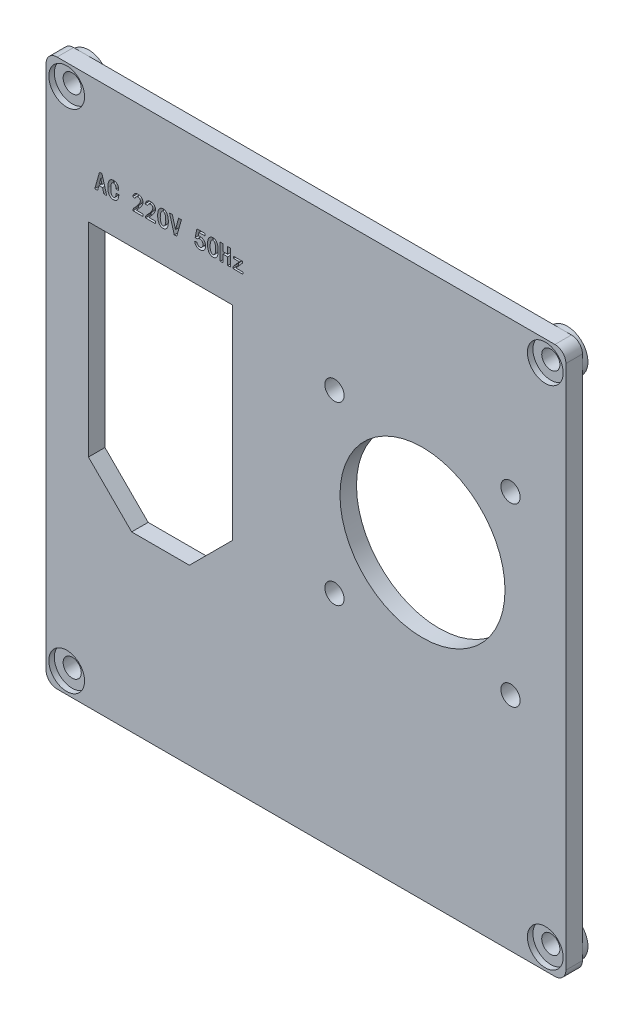
from build123d import *

# Parameters (mm, degrees)
SKETCH_1_R                  = 1.75
SKETCH_1_R_2                = 15
EXTRUDE_1_DEPTH             = 3
CUT_EXTRUDE_START           = 32.437993691
CUT_EXTRUDE_1_OUTLINE_W     = 0.515775918
CUT_EXTRUDE_1_OUTLINE_H     = 1
CUT_EXTRUDE_1_OUTLINE_W_2   = 0.515775917
CUT_EXTRUDE_1_DEPTH         = 3
CUT_EXTRUDE_START_2         = 32.454735481
CUT_EXTRUDE_1_2_OUTLINE_W   = 1.847392145
CUT_EXTRUDE_1_2_OUTLINE_H   = 1
CUT_EXTRUDE_1_2_OUTLINE_W_2 = 1.847392144
CUT_EXTRUDE_1_2_OUTLINE_W_3 = 1.779137154
CUT_EXTRUDE_1_2_DEPTH       = 0.112041111
CUT_EXTRUDE_START_3         = 34.11474836
CUT_EXTRUDE_1_3_OUTLINE_W   = 1.625241469
CUT_EXTRUDE_1_3_OUTLINE_H   = 1
CUT_EXTRUDE_1_3_DEPTH       = 0.316806181
CUT_EXTRUDE_1_4_OUTLINE_W   = 1.710882164
CUT_EXTRUDE_1_4_OUTLINE_H   = 1
CUT_EXTRUDE_1_4_DEPTH       = 0.355441082
CUT_EXTRUDE_START_4         = 33.803093498
CUT_EXTRUDE_1_5_OUTLINE_W   = 0.849323889
CUT_EXTRUDE_1_5_OUTLINE_H   = 1
CUT_EXTRUDE_1_5_DEPTH       = 0.406310367
CUT_EXTRUDE_1_6_OUTLINE_W   = 0.06825499
CUT_EXTRUDE_1_6_OUTLINE_H   = 1
CUT_EXTRUDE_1_6_DEPTH       = 0.329040567
CUT_EXTRUDE_START_5         = 2
CUT_EXTRUDE_1_7_DEPTH       = 2
SKETCH_3_R                  = 3.75
EXTRUDE_2_DEPTH             = 1
SKETCH_4_R                  = 1.65
CUT_EXTRUDE_2_DEPTH         = 69.72863319
SKETCH_5_R                  = 3.25
CUT_EXTRUDE_3_DEPTH         = 1


with BuildPart() as part:
    # 草图1 → 凸台-拉伸1 (new body)
    with BuildSketch(Plane.XY):
        with BuildLine():
            Line((-45.25, -49.75), (45.25, -49.75))
            ThreePointArc((45.25, -49.75), (46.664213562, -49.164213562), (47.25, -47.75))
            Line((47.25, -47.75), (47.25, 47.75))
            ThreePointArc((47.25, 47.75), (46.664213562, 49.164213562), (45.25, 49.75))
            Line((45.25, 49.75), (-45.25, 49.75))
            ThreePointArc((-45.25, 49.75), (-46.664213562, 49.164213562), (-47.25, 47.75))
            Line((-47.25, 47.75), (-47.25, -47.75))
            ThreePointArc((-47.25, -47.75), (-46.664213562, -49.164213562), (-45.25, -49.75))
        make_face()
        with Locations((5.176207271, 22.529672013)):
            Circle(SKETCH_1_R, mode=Mode.SUBTRACT)
        with Locations((37.176207271, 22.529672013)):
            Circle(SKETCH_1_R, mode=Mode.SUBTRACT)
        with Locations((37.176207271, -9.470327987)):
            Circle(SKETCH_1_R, mode=Mode.SUBTRACT)
        with Locations((5.176207271, -9.470327987)):
            Circle(SKETCH_1_R, mode=Mode.SUBTRACT)
        with Locations((21.176207271, 6.529672013)):
            Circle(SKETCH_1_R_2, mode=Mode.SUBTRACT)
        Polygon((-39.546370112, 26.657371429), (-13.337865468, 26.657371429), (-13.337865468, -10.372264242), (-21.192935607, -18.227334381), (-31.691299973, -18.227334381), (-39.546370112, -10.372264242), align=None, mode=Mode.SUBTRACT)
    extrude(amount=EXTRUDE_1_DEPTH)

    # 切除-拉伸1: read off the stored shape, not the designer's step
    # 切除-拉伸1 outline → 切除-拉伸1 (cut)
    with BuildSketch(Plane(origin=(0, 0, 0), x_dir=(1, 0, 0), z_dir=(0, 1, 0)).offset(CUT_EXTRUDE_START)):
        with Locations((-13.968422965, -2.5)):
            Rectangle(CUT_EXTRUDE_1_OUTLINE_W, CUT_EXTRUDE_1_OUTLINE_H)
        with Locations((-15.333522772, -2.5)):
            Rectangle(CUT_EXTRUDE_1_OUTLINE_W_2, CUT_EXTRUDE_1_OUTLINE_H)
    extrude(amount=CUT_EXTRUDE_1_DEPTH, mode=Mode.SUBTRACT)

    # Cut-Extrude 1 2 outline → Cut-Extrude 1 2 (cut)
    with BuildSketch(Plane(origin=(0, 0, 0), x_dir=(1, 0, 0), z_dir=(0, 1, 0)).offset(CUT_EXTRUDE_START_2)):
        with Locations((-30.517038548, -2.5)):
            Rectangle(CUT_EXTRUDE_1_2_OUTLINE_W, CUT_EXTRUDE_1_2_OUTLINE_H)
        with Locations((-28.250457736, -2.5)):
            Rectangle(CUT_EXTRUDE_1_2_OUTLINE_W_2, CUT_EXTRUDE_1_2_OUTLINE_H)
        with Locations((-12.384392057, -2.5)):
            Rectangle(CUT_EXTRUDE_1_2_OUTLINE_W_3, CUT_EXTRUDE_1_2_OUTLINE_H)
    extrude(amount=CUT_EXTRUDE_1_2_DEPTH, mode=Mode.SUBTRACT)

    # Cut-Extrude 1 3 outline → Cut-Extrude 1 3 (cut)
    with BuildSketch(Plane(origin=(0, 0, 0), x_dir=(1, 0, 0), z_dir=(0, 1, 0)).offset(CUT_EXTRUDE_START_3)):
        with Locations((-12.39308491, -2.5)):
            Rectangle(CUT_EXTRUDE_1_3_OUTLINE_W, CUT_EXTRUDE_1_3_OUTLINE_H)
    extrude(amount=CUT_EXTRUDE_1_3_DEPTH, mode=Mode.SUBTRACT)

    # Cut-Extrude 1 4 outline → Cut-Extrude 1 4 (cut)
    with BuildSketch(Plane(origin=(0, 0, 0), x_dir=(1, 0, 0), z_dir=(0, 1, 0)).offset(CUT_EXTRUDE_START)):
        with Locations((-12.350264562, -2.5)):
            Rectangle(CUT_EXTRUDE_1_4_OUTLINE_W, CUT_EXTRUDE_1_4_OUTLINE_H)
    extrude(amount=CUT_EXTRUDE_1_4_DEPTH, mode=Mode.SUBTRACT)

    # Cut-Extrude 1 5 outline → Cut-Extrude 1 5 (cut)
    with BuildSketch(Plane(origin=(0, 0, 0), x_dir=(1, 0, 0), z_dir=(0, 1, 0)).offset(CUT_EXTRUDE_START_4)):
        with Locations((-14.650972869, -2.5)):
            Rectangle(CUT_EXTRUDE_1_5_OUTLINE_W, CUT_EXTRUDE_1_5_OUTLINE_H)
    extrude(amount=CUT_EXTRUDE_1_5_DEPTH, mode=Mode.SUBTRACT)

    # Cut-Extrude 1 6 outline → Cut-Extrude 1 6 (cut)
    with BuildSketch(Plane(origin=(0, 0, 0), x_dir=(1, 0, 0), z_dir=(0, 1, 0)).offset(CUT_EXTRUDE_START)):
        with Locations((-13.239833139, -2.5)):
            Rectangle(CUT_EXTRUDE_1_6_OUTLINE_W, CUT_EXTRUDE_1_6_OUTLINE_H)
    extrude(amount=CUT_EXTRUDE_1_6_DEPTH, mode=Mode.SUBTRACT)

    # Cut-Extrude 1 7 outline → Cut-Extrude 1 7 (cut)
    with BuildSketch(Plane.XY.offset(CUT_EXTRUDE_START_5)):
        with BuildLine():
            add(Edge.make_bspline(
                [(-17.892119037, 34.128270575), (-17.890696642, 34.165641823), (-17.887121571, 34.238507118), (-17.877981101, 34.344565154), (-17.86657254, 34.444903851), (-17.852013781, 34.539267275), (-17.833791644, 34.627705183), (-17.813471807, 34.710352965), (-17.789744137, 34.787173153), (-17.753884053, 34.880804228), (-17.701382584, 34.989437243), (-17.625059007, 35.108960492), (-17.535407508, 35.216325394), (-17.451367259, 35.296462565), (-17.377543042, 35.352666192), (-17.318150166, 35.389539302), (-17.254883884, 35.42044642), (-17.188154791, 35.44545014), (-17.118266573, 35.465703637), (-17.044542741, 35.479729806), (-16.967228258, 35.488006258), (-16.887397568, 35.490393737), (-16.807045456, 35.487510364), (-16.728575542, 35.4740096), (-16.652687981, 35.453585757), (-16.579644128, 35.424446821), (-16.509672561, 35.386837809), (-16.442956588, 35.340572233), (-16.379033245, 35.286111164), (-16.318413435, 35.224106733), (-16.262540703, 35.15579349), (-16.209637499, 35.084795009), (-16.164458691, 35.008654946), (-16.122687144, 34.930390032), (-16.087611101, 34.847834255), (-16.056028715, 34.762419204), (-16.032281099, 34.672508459), (-16.005148036, 34.546897887), (-15.9825224, 34.380691879), (-15.97009504, 34.225029144), (-15.966186349, 34.134931511), (-15.965468152, 34.11474836)],
                knots=[0, 0, 0, 0, 0.01375814, 0.02683405, 0.039155756, 0.050904718, 0.061946445, 0.072364933, 0.082205407, 0.091503087, 0.109231915, 0.126492414, 0.143538444, 0.160575876, 0.169088276, 0.177634305, 0.186251179, 0.194948003, 0.203820502, 0.212988516, 0.222519663, 0.232395241, 0.242356006, 0.252040315, 0.261618449, 0.271222912, 0.280903035, 0.290781455, 0.301033734, 0.311754852, 0.322633587, 0.3334842, 0.344291052, 0.355169787, 0.366098274, 0.377263545, 0.388642339, 0.40027369, 0.424528945, 0.450274304, 0.457703597, 0.457703597, 0.457703597, 0.457703597], degree=3))
            add(Edge.make_bspline(
                [(-17.892616098, 34.11474836), (-17.892456166, 34.119255937), (-17.892290588, 34.123763346), (-17.892119037, 34.128270575)],
                knots=[0.998340674, 0.998340674, 0.998340674, 0.998340674, 1, 1, 1, 1], degree=3))
            Line((-17.892616098, 34.11474836), (-17.421181141, 34.11474836))
            add(Edge.make_bspline(
                [(-17.41111453, 34.22678957), (-17.415082506, 34.189498468), (-17.418422869, 34.15214396), (-17.421181141, 34.11474836)],
                knots=[0, 0, 0, 0, 0.02075965, 0.02075965, 0.02075965, 0.02075965], degree=3))
            add(Edge.make_bspline(
                [(-16.431048092, 34.11474836), (-16.431057352, 34.114962999), (-16.433152925, 34.163496819), (-16.437979413, 34.258054022), (-16.448997325, 34.396102362), (-16.466431633, 34.527431733), (-16.496815993, 34.651429407), (-16.539326146, 34.767618481), (-16.584321231, 34.857864237), (-16.625344447, 34.923301433), (-16.657613901, 34.96663992), (-16.692345355, 35.002932941), (-16.727983989, 35.034266193), (-16.766172194, 35.058059334), (-16.806084652, 35.075744732), (-16.847669231, 35.087603092), (-16.890693569, 35.092607326), (-16.934097136, 35.091367318), (-16.976866799, 35.083572571), (-17.018844433, 35.069190157), (-17.059543535, 35.047442928), (-17.099631029, 35.019451173), (-17.138969343, 34.985183687), (-17.177135592, 34.944016209), (-17.214420683, 34.896379659), (-17.250287542, 34.841386752), (-17.282035714, 34.777619918), (-17.312008697, 34.706196995), (-17.336773269, 34.625851523), (-17.36143762, 34.538122072), (-17.380435147, 34.441521827), (-17.398136716, 34.337020134), (-17.407108458, 34.264438689), (-17.41111453, 34.22678957)],
                knots=[0.581565079, 0.581565079, 0.581565079, 0.581565079, 0.581684015, 0.608458794, 0.63397824, 0.658345663, 0.681719281, 0.704501222, 0.726714831, 0.737396332, 0.747235582, 0.756565828, 0.76516276, 0.773438321, 0.78136528, 0.789265473, 0.797283646, 0.805248812, 0.81322018, 0.821262092, 0.829713246, 0.838679214, 0.848281689, 0.85853832, 0.869710881, 0.881741515, 0.89481499, 0.909092914, 0.924575528, 0.941323834, 0.959525027, 0.979041045, 1, 1, 1, 1], degree=3))
            Line((-16.431048092, 34.11474836), (-15.965468152, 34.11474836))
        make_face()
        with BuildLine():
            add(Edge.make_bspline(
                [(-15.965468152, 34.11474836), (-15.963536806, 34.060472603), (-15.961588077, 33.927321129), (-15.966884374, 33.754408086), (-15.977539461, 33.597929793), (-15.989576246, 33.484049342), (-16.006020098, 33.375672697), (-16.024532412, 33.272231729), (-16.049608446, 33.174510916), (-16.076942589, 33.081508644), (-16.108380771, 32.993920075), (-16.143929135, 32.911697408), (-16.18333993, 32.834646591), (-16.229658891, 32.763941173), (-16.280968617, 32.69908582), (-16.33743758, 32.639753169), (-16.387793088, 32.596806704), (-16.419256339, 32.57365332), (-16.42902494, 32.566776592)],
                knots=[0.457703597, 0.457703597, 0.457703597, 0.457703597, 0.477682166, 0.506675045, 0.521319447, 0.535376407, 0.548788473, 0.561642915, 0.57401487, 0.585881854, 0.597296758, 0.608225244, 0.618820876, 0.629092903, 0.639267036, 0.649208376, 0.6591779, 0.663571181, 0.663571181, 0.663571181, 0.663571181], degree=3))
            Line((-15.965468152, 34.11474836), (-16.431048092, 34.11474836))
            add(Edge.make_bspline(
                [(-17.421181141, 34.11474836), (-17.421260296, 34.113675202), (-17.424058389, 34.075507366), (-17.428330778, 34.001070736), (-17.431519135, 33.892378036), (-17.428206185, 33.786939101), (-17.423211944, 33.684595482), (-17.411905359, 33.585809565), (-17.397065145, 33.490007828), (-17.37889301, 33.398129456), (-17.356230241, 33.311428693), (-17.331336714, 33.231266573), (-17.304402213, 33.157711048), (-17.274411243, 33.091545107), (-17.241348959, 33.032360354), (-17.206026875, 32.980223611), (-17.168726472, 32.934258189), (-17.128029296, 32.896469988), (-17.086164139, 32.865261705), (-17.043525865, 32.841218555), (-17.000668132, 32.824102554), (-16.957453071, 32.814152406), (-16.913702086, 32.81151729), (-16.869698101, 32.816386016), (-16.825223615, 32.827171349), (-16.781514932, 32.84640665), (-16.738860169, 32.871388472), (-16.697619222, 32.901619257), (-16.660562062, 32.938961204), (-16.625417185, 32.981040699), (-16.593288827, 33.029058745), (-16.563748432, 33.082456936), (-16.537214599, 33.141743933), (-16.505730246, 33.228975779), (-16.473271091, 33.345603331), (-16.444850254, 33.492001293), (-16.4282509, 33.645364659), (-16.423561602, 33.803063354), (-16.425236051, 33.960252205), (-16.428863414, 34.064110006), (-16.431048092, 34.11474836)],
                knots=[0.02075965, 0.02075965, 0.02075965, 0.02075965, 0.021355399, 0.041947328, 0.062035245, 0.081529183, 0.100334779, 0.118745782, 0.136543744, 0.153998836, 0.170571273, 0.186131217, 0.200456533, 0.213910078, 0.22630606, 0.237940496, 0.248742933, 0.258999564, 0.268601304, 0.277592435, 0.28602184, 0.29406463, 0.302040425, 0.310163575, 0.318492712, 0.327277305, 0.336489515, 0.345829594, 0.355492903, 0.365534577, 0.376147113, 0.38742346, 0.399283875, 0.412065712, 0.438736923, 0.466213421, 0.494545127, 0.5240344, 0.553505232, 0.581565079, 0.581565079, 0.581565079, 0.581565079], degree=3))
            Line((-17.421181141, 34.11474836), (-17.892616098, 34.11474836))
            add(Edge.make_bspline(
                [(-17.393412018, 32.566776592), (-17.414483751, 32.580765343), (-17.455206019, 32.610075048), (-17.511546857, 32.658487896), (-17.563621409, 32.708971567), (-17.608683541, 32.763807388), (-17.649207088, 32.820807364), (-17.692760889, 32.902172857), (-17.740251627, 33.006461019), (-17.788395252, 33.134833197), (-17.828876886, 33.265595251), (-17.853837712, 33.377819093), (-17.870589201, 33.471411806), (-17.879740221, 33.547981991), (-17.887704006, 33.630401887), (-17.892516541, 33.718696765), (-17.89569899, 33.812726537), (-17.897136322, 33.912559915), (-17.895573739, 34.013883876), (-17.893781008, 34.081916289), (-17.892616098, 34.11474836)],
                knots=[0.790168782, 0.790168782, 0.790168782, 0.790168782, 0.799471656, 0.808601844, 0.817479964, 0.826114187, 0.834679165, 0.843161847, 0.860016036, 0.876808885, 0.893569584, 0.910331214, 0.919068096, 0.928539194, 0.938690933, 0.949527458, 0.961062992, 0.973303463, 0.986254556, 0.998340674, 0.998340674, 0.998340674, 0.998340674], degree=3))
            Line((-17.393412018, 32.566776592), (-16.42902494, 32.566776592))
        make_face()
        with BuildLine():
            add(Edge.make_bspline(
                [(-16.42902494, 32.566776592), (-16.441709922, 32.557846841), (-16.477878945, 32.533834521), (-16.54057517, 32.498442307), (-16.617792008, 32.463150067), (-16.69783264, 32.435707183), (-16.778203242, 32.416073798), (-16.85831526, 32.405777396), (-16.937985016, 32.403568891), (-17.017205545, 32.410896499), (-17.096054534, 32.426391856), (-17.174042611, 32.451202484), (-17.250660036, 32.483826398), (-17.323447106, 32.52305657), (-17.370516497, 32.551595979), (-17.393088466, 32.566561798), (-17.393412018, 32.566776592)],
                knots=[0.663571181, 0.663571181, 0.663571181, 0.663571181, 0.669276061, 0.679530773, 0.690026183, 0.700464403, 0.710615221, 0.720409648, 0.730125134, 0.739876495, 0.749617299, 0.759632065, 0.769928041, 0.78020735, 0.790025939, 0.790168782, 0.790168782, 0.790168782, 0.790168782], degree=3))
            Line((-16.42902494, 32.566776592), (-17.393412018, 32.566776592))
        make_face()
        Polygon((-11.580464175, 34.11474836), (-13.205705644, 34.11474836), (-13.205705644, 34.076113459), (-12.113625798, 34.076113459), (-13.273960634, 32.767034258), (-13.205705644, 32.767034258), (-13.205705644, 32.793434773), (-12.740799011, 32.793434773), align=None)
        with BuildLine():
            Line((-20.106349172, 34.11474836), (-18.436437247, 34.11474836))
            add(Edge.make_bspline(
                [(-19.625538226, 34.380041341), (-19.611530001, 34.389525035), (-19.583598469, 34.408434934), (-19.538728681, 34.432329551), (-19.491532395, 34.452320997), (-19.442032741, 34.468505392), (-19.390023759, 34.479995874), (-19.335776973, 34.487649351), (-19.278960065, 34.49166866), (-19.200134469, 34.490294487), (-19.100873737, 34.480940163), (-18.982414145, 34.459486253), (-18.866516738, 34.423882755), (-18.754182165, 34.379166482), (-18.649698338, 34.325519223), (-18.560152081, 34.260350468), (-18.487585374, 34.191268651), (-18.451560614, 34.139231936), (-18.436437247, 34.11474836)],
                knots=[0, 0, 0, 0, 0.009976857, 0.019893235, 0.029938193, 0.040191786, 0.050577508, 0.061324553, 0.072496083, 0.084149044, 0.107805093, 0.131255114, 0.155056848, 0.179211149, 0.202553181, 0.224138131, 0.244379192, 0.261329406, 0.261329406, 0.261329406, 0.261329406], degree=3))
            add(Edge.make_bspline(
                [(-19.46391556, 35.031683324), (-19.470476747, 34.997108404), (-19.483206627, 34.930026858), (-19.503276387, 34.832594022), (-19.523063805, 34.741542109), (-19.542902812, 34.656656155), (-19.563670156, 34.578666264), (-19.583409934, 34.506561682), (-19.603898729, 34.441082032), (-19.61855207, 34.399747887), (-19.625538226, 34.380041341)],
                knots=[0, 0, 0, 0, 0.1570846, 0.304772297, 0.444024214, 0.572999318, 0.693839289, 0.804255937, 0.906676684, 1, 1, 1, 1], degree=3))
            Line((-19.46391556, 35.031683324), (-18.362820904, 35.031683324))
            Line((-18.362820904, 35.031683324), (-18.362820904, 35.421251901))
            Line((-18.362820904, 35.421251901), (-19.827083622, 35.421251901))
            add(Edge.make_bspline(
                [(-20.106349172, 34.11474836), (-20.102729834, 34.130838717), (-20.09299233, 34.17411731), (-20.077721803, 34.248118797), (-20.057507108, 34.33945307), (-20.035346319, 34.440660845), (-20.012908343, 34.552138485), (-19.985766981, 34.672898584), (-19.958457118, 34.803740819), (-19.928812718, 34.944369018), (-19.896619159, 35.094570843), (-19.862354963, 35.254661888), (-19.839081909, 35.364582809), (-19.827083622, 35.421251901)],
                knots=[0.154059826, 0.154059826, 0.154059826, 0.154059826, 0.185387301, 0.238324019, 0.297582749, 0.363077412, 0.435122637, 0.513574185, 0.598176239, 0.689014721, 0.786573079, 0.88996899, 1, 1, 1, 1], degree=3))
        make_face()
        with BuildLine():
            add(Edge.make_bspline(
                [(-18.436437247, 34.11474836), (-18.434193162, 34.111115358), (-18.415353508, 34.08007913), (-18.383885133, 34.020637387), (-18.344185068, 33.93687401), (-18.312672048, 33.853167642), (-18.287125804, 33.770027263), (-18.267944338, 33.685504792), (-18.256953512, 33.598177205), (-18.250668023, 33.507843463), (-18.25255674, 33.414676075), (-18.259541641, 33.319407062), (-18.276496005, 33.222939172), (-18.299398746, 33.125159313), (-18.329949401, 33.027429512), (-18.368201048, 32.932434433), (-18.417669241, 32.84392675), (-18.477158781, 32.763023211), (-18.54676594, 32.689945386), (-18.625084364, 32.624078913), (-18.682498418, 32.585348208), (-18.712524997, 32.566991079), (-18.712876245, 32.566776592)],
                knots=[0.261329406, 0.261329406, 0.261329406, 0.261329406, 0.263844567, 0.282716609, 0.301019044, 0.318496537, 0.335444207, 0.352314082, 0.369563844, 0.387332166, 0.405698908, 0.424505385, 0.443640794, 0.46342496, 0.483734459, 0.504009175, 0.523741379, 0.543399058, 0.5631093, 0.583153252, 0.603668649, 0.603911399, 0.603911399, 0.603911399, 0.603911399], degree=3))
            Line((-18.436437247, 34.11474836), (-20.106349172, 34.11474836))
            add(Edge.make_bspline(
                [(-20.158699848, 33.877143723), (-20.157005059, 33.88487584), (-20.152902485, 33.903592959), (-20.14499967, 33.936342185), (-20.135200673, 33.978981998), (-20.124723497, 34.031760796), (-20.114595649, 34.078083675), (-20.108135312, 34.106807782), (-20.106349172, 34.11474836)],
                knots=[0, 0, 0, 0, 0.015035692, 0.036396868, 0.063992105, 0.098135437, 0.138599743, 0.154059826, 0.154059826, 0.154059826, 0.154059826], degree=3))
            Line((-20.158699848, 33.877143723), (-19.778789996, 33.837220993))
            add(Edge.make_bspline(
                [(-19.830303197, 33.339474696), (-19.819795954, 33.302123773), (-19.799804995, 33.231060334), (-19.76114871, 33.133050824), (-19.721117991, 33.047133267), (-19.674563757, 32.975754726), (-19.626367547, 32.915896153), (-19.5724745, 32.870515104), (-19.51504581, 32.837559355), (-19.453623832, 32.820373175), (-19.392866558, 32.812454115), (-19.33415168, 32.807238822), (-19.277947371, 32.808350873), (-19.224246659, 32.812361414), (-19.17318797, 32.821846107), (-19.125222488, 32.837338505), (-19.079153597, 32.855313135), (-19.023200565, 32.887731221), (-18.959135439, 32.933843386), (-18.892683999, 32.998603117), (-18.838413024, 33.072026012), (-18.795859823, 33.153157914), (-18.764517591, 33.240826957), (-18.744054202, 33.334123937), (-18.733160732, 33.432109707), (-18.732643629, 33.533100924), (-18.742135402, 33.632649131), (-18.764014741, 33.726289519), (-18.797213158, 33.811892256), (-18.843624482, 33.887268708), (-18.897884843, 33.953001692), (-18.959982319, 34.007536902), (-19.029215079, 34.050050957), (-19.104924775, 34.080016722), (-19.185408635, 34.099009873), (-19.269864471, 34.105085968), (-19.357476558, 34.099581337), (-19.431709369, 34.085951836), (-19.491635283, 34.068518864), (-19.535938929, 34.049595864), (-19.579560804, 34.026242979), (-19.621893676, 33.997811247), (-19.663192697, 33.964811905), (-19.703365025, 33.927259258), (-19.742129919, 33.884448526), (-19.766331036, 33.853271313), (-19.778789996, 33.837220993)],
                knots=[0, 0, 0, 0, 0.034936196, 0.066469208, 0.09483979, 0.120159877, 0.143089317, 0.163815179, 0.18329447, 0.202263043, 0.220834079, 0.238485091, 0.25531164, 0.27142048, 0.286971718, 0.301958335, 0.316790674, 0.331423724, 0.360088745, 0.387713903, 0.414673727, 0.442011033, 0.469967938, 0.498307523, 0.527886972, 0.558637517, 0.589157929, 0.617772671, 0.645030509, 0.671498197, 0.697176183, 0.721573204, 0.745620481, 0.770005234, 0.794633417, 0.819849149, 0.846003388, 0.87354176, 0.887675543, 0.902150546, 0.916860076, 0.932200645, 0.948027232, 0.964446527, 0.981696742, 1, 1, 1, 1], degree=3))
            Line((-19.830303197, 33.339474696), (-20.244340544, 33.241599615))
            add(Edge.make_bspline(
                [(-19.866783073, 32.566776592), (-19.88282671, 32.577282387), (-19.919491495, 32.602453902), (-19.974074402, 32.647834049), (-20.026598375, 32.707290537), (-20.07506395, 32.77463046), (-20.119110094, 32.850726871), (-20.158114306, 32.935730209), (-20.192000133, 33.029760571), (-20.221941959, 33.132266856), (-20.236707666, 33.204341743), (-20.244340544, 33.241599615)],
                knots=[0.843503786, 0.843503786, 0.843503786, 0.843503786, 0.854817764, 0.869737288, 0.885251897, 0.901491932, 0.918631607, 0.937048937, 0.956602293, 0.977566302, 1, 1, 1, 1], degree=3))
            Line((-19.866783073, 32.566776592), (-18.712876245, 32.566776592))
        make_face()
        with BuildLine():
            add(Edge.make_bspline(
                [(-18.712876245, 32.566776592), (-18.743283945, 32.54820832), (-18.807585766, 32.512836153), (-18.910658153, 32.467931495), (-19.022193356, 32.432185914), (-19.141675073, 32.408974103), (-19.268396558, 32.399206772), (-19.377897123, 32.400958096), (-19.467230422, 32.410200633), (-19.534213212, 32.42167616), (-19.600445905, 32.438329215), (-19.66503118, 32.461411567), (-19.729422522, 32.48735185), (-19.791989578, 32.520060636), (-19.837275831, 32.547677892), (-19.862153006, 32.563744703), (-19.866783073, 32.566776592)],
                knots=[0.603911399, 0.603911399, 0.603911399, 0.603911399, 0.624926349, 0.647161813, 0.670153821, 0.693900225, 0.71880721, 0.745029719, 0.758401288, 0.771769257, 0.785101177, 0.798639659, 0.812211276, 0.826032945, 0.840238662, 0.843503786, 0.843503786, 0.843503786, 0.843503786], degree=3))
            Line((-18.712876245, 32.566776592), (-19.866783073, 32.566776592))
        make_face()
        Polygon((-23.51725031, 34.11474836), (-23.017776481, 34.11474836), (-22.640348271, 35.437993691), (-23.163851168, 35.437993691), align=None)
        Polygon((-23.459303233, 32.566776592), (-23.017776481, 34.11474836), (-23.51725031, 34.11474836), (-23.726973063, 33.329475789), (-23.936922053, 34.11474836), (-24.43532475, 34.11474836), (-23.995112065, 32.566776592), align=None)
        Polygon((-23.505770035, 32.403866196), (-23.459303233, 32.566776592), (-23.995112065, 32.566776592), (-23.948783557, 32.403866196), align=None)
        Polygon((-24.43532475, 34.11474836), (-23.936922053, 34.11474836), (-24.290702424, 35.437993691), (-24.811629662, 35.437993691), align=None)
        with BuildLine():
            Line((-29.174153808, 32.566776692), (-27.326761664, 32.566776592))
            Line((-27.326761664, 32.566776592), (-27.326761664, 32.844304058))
            Line((-27.326761664, 32.844304058), (-28.55535149, 32.844304058))
            add(Edge.make_bspline(
                [(-27.537596449, 34.11474836), (-27.551695594, 34.089186755), (-27.583959063, 34.032569389), (-27.639960199, 33.943873007), (-27.707833884, 33.843544242), (-27.789700348, 33.73463258), (-27.883616405, 33.6131271), (-27.992001285, 33.481164019), (-28.11297615, 33.337105275), (-28.24870963, 33.183144304), (-28.396457309, 33.016511896), (-28.501059081, 32.903145599), (-28.55535149, 32.844304058)],
                knots=[0.557585185, 0.557585185, 0.557585185, 0.557585185, 0.58133334, 0.610601225, 0.642910399, 0.679865703, 0.721436889, 0.767860717, 0.818799669, 0.874494463, 0.934857719, 1, 1, 1, 1], degree=3))
            Line((-27.537596449, 34.11474836), (-28.056386169, 34.11474836))
            add(Edge.make_bspline(
                [(-29.174153808, 32.566776692), (-29.17210011, 32.58917879), (-29.167995245, 32.633955376), (-29.152530128, 32.699366109), (-29.132045347, 32.763393041), (-29.104237148, 32.825058448), (-29.069776222, 32.884690873), (-29.028929677, 32.942143285), (-28.981818289, 32.997806631), (-28.927017357, 33.05116015), (-28.867569072, 33.106913076), (-28.805560768, 33.169893305), (-28.740298884, 33.239871246), (-28.671434174, 33.316551106), (-28.598967045, 33.399952809), (-28.523404955, 33.490507731), (-28.444066181, 33.588026485), (-28.362875879, 33.689776836), (-28.283808068, 33.792121645), (-28.210607845, 33.890595252), (-28.14401816, 33.982212082), (-28.093822926, 34.056532328), (-28.065702266, 34.100085682), (-28.056386169, 34.11474836)],
                knots=[0, 0, 0, 0, 0.016926228, 0.033831593, 0.050499485, 0.067506599, 0.084672818, 0.102302554, 0.120540831, 0.139518724, 0.15987365, 0.181938605, 0.206074378, 0.231948146, 0.259568851, 0.289295459, 0.32078355, 0.354265258, 0.387347976, 0.418196573, 0.446689801, 0.472653833, 0.485739218, 0.485739218, 0.485739218, 0.485739218], degree=3))
        make_face()
        Polygon((-37.436884977, 34.11474836), (-37.916536971, 34.11474836), (-38.393728824, 32.437993691), (-37.872157672, 32.437993691), (-37.633265206, 33.342050356), (-36.985486712, 33.342050356), (-36.746594246, 32.437993691), (-36.222447434, 32.437993691), (-36.701062678, 34.11474836), (-37.180918378, 34.11474836), (-37.080142218, 33.749004638), (-37.536677955, 33.749004638), align=None)
        Polygon((-37.530238805, 35.472121186), (-37.916536971, 34.11474836), (-37.436884977, 34.11474836), (-37.309529047, 34.581510982), (-37.180918378, 34.11474836), (-36.701062678, 34.11474836), (-37.088513113, 35.472121186), align=None)
        with BuildLine():
            Line((-26.459735263, 32.566776592), (-25.495348185, 32.566776592))
            add(Edge.make_bspline(
                [(-25.031791398, 34.11474836), (-25.029860051, 34.060472603), (-25.027911322, 33.927321129), (-25.033207619, 33.754408086), (-25.043862706, 33.597929793), (-25.055899491, 33.484049342), (-25.072343343, 33.375672697), (-25.090855657, 33.272231729), (-25.115931691, 33.174510916), (-25.143265834, 33.081508644), (-25.174704016, 32.993920075), (-25.21025238, 32.911697408), (-25.249663175, 32.834646591), (-25.295982136, 32.763941173), (-25.347291862, 32.69908582), (-25.403760825, 32.639753169), (-25.454116334, 32.596806704), (-25.485579584, 32.57365332), (-25.495348185, 32.566776592)],
                knots=[0.457703597, 0.457703597, 0.457703597, 0.457703597, 0.477682166, 0.506675045, 0.521319447, 0.535376407, 0.548788473, 0.561642915, 0.57401487, 0.585881854, 0.597296758, 0.608225244, 0.618820876, 0.629092903, 0.639267036, 0.649208376, 0.6591779, 0.663571181, 0.663571181, 0.663571181, 0.663571181], degree=3))
            Line((-25.031791398, 34.11474836), (-25.497371337, 34.11474836))
            add(Edge.make_bspline(
                [(-26.487504386, 34.11474836), (-26.487583541, 34.113675202), (-26.490381635, 34.075507366), (-26.494654023, 34.001070736), (-26.49784238, 33.892378036), (-26.49452943, 33.786939101), (-26.489535189, 33.684595482), (-26.478228604, 33.585809565), (-26.46338839, 33.490007828), (-26.445216255, 33.398129456), (-26.422553486, 33.311428693), (-26.397659959, 33.231266573), (-26.370725459, 33.157711048), (-26.340734488, 33.091545107), (-26.307672204, 33.032360354), (-26.272350121, 32.980223611), (-26.235049717, 32.934258189), (-26.194352541, 32.896469988), (-26.152487385, 32.865261705), (-26.109849111, 32.841218555), (-26.066991377, 32.824102554), (-26.023776316, 32.814152406), (-25.980025331, 32.81151729), (-25.936021347, 32.816386016), (-25.89154686, 32.827171349), (-25.847838177, 32.84640665), (-25.805183414, 32.871388472), (-25.763942467, 32.901619257), (-25.726885307, 32.938961204), (-25.69174043, 32.981040699), (-25.659612072, 33.029058745), (-25.630071678, 33.082456936), (-25.603537844, 33.141743933), (-25.572053491, 33.228975779), (-25.539594337, 33.345603331), (-25.511173499, 33.492001293), (-25.494574146, 33.645364659), (-25.489884847, 33.803063354), (-25.491559296, 33.960252205), (-25.49518666, 34.064110006), (-25.497371337, 34.11474836)],
                knots=[0.02075965, 0.02075965, 0.02075965, 0.02075965, 0.021355399, 0.041947328, 0.062035245, 0.081529183, 0.100334779, 0.118745782, 0.136543744, 0.153998836, 0.170571273, 0.186131217, 0.200456533, 0.213910078, 0.22630606, 0.237940496, 0.248742933, 0.258999564, 0.268601304, 0.277592435, 0.28602184, 0.29406463, 0.302040425, 0.310163575, 0.318492712, 0.327277305, 0.336489515, 0.345829594, 0.355492903, 0.365534577, 0.376147113, 0.38742346, 0.399283875, 0.412065712, 0.438736923, 0.466213421, 0.494545127, 0.5240344, 0.553505232, 0.581565079, 0.581565079, 0.581565079, 0.581565079], degree=3))
            Line((-26.487504386, 34.11474836), (-26.958939344, 34.11474836))
            add(Edge.make_bspline(
                [(-26.459735263, 32.566776592), (-26.480806996, 32.580765343), (-26.521529264, 32.610075048), (-26.577870102, 32.658487896), (-26.629944654, 32.708971567), (-26.675006786, 32.763807388), (-26.715530334, 32.820807364), (-26.759084134, 32.902172857), (-26.806574873, 33.006461019), (-26.854718497, 33.134833197), (-26.895200131, 33.265595251), (-26.920160957, 33.377819093), (-26.936912446, 33.471411806), (-26.946063467, 33.547981991), (-26.954027252, 33.630401887), (-26.958839786, 33.718696765), (-26.962022235, 33.812726537), (-26.963459567, 33.912559915), (-26.961896984, 34.013883876), (-26.960104253, 34.081916289), (-26.958939344, 34.11474836)],
                knots=[0.790168782, 0.790168782, 0.790168782, 0.790168782, 0.799471656, 0.808601844, 0.817479964, 0.826114187, 0.834679165, 0.843161847, 0.860016036, 0.876808885, 0.893569584, 0.910331214, 0.919068096, 0.928539194, 0.938690933, 0.949527458, 0.961062992, 0.973303463, 0.986254556, 0.998340674, 0.998340674, 0.998340674, 0.998340674], degree=3))
        make_face()
        with BuildLine():
            add(Edge.make_bspline(
                [(-25.495348185, 32.566776592), (-25.508033167, 32.557846841), (-25.544202191, 32.533834521), (-25.606898416, 32.498442307), (-25.684115253, 32.463150067), (-25.764155885, 32.435707183), (-25.844526487, 32.416073798), (-25.924638505, 32.405777396), (-26.004308262, 32.403568891), (-26.083528791, 32.410896499), (-26.162377779, 32.426391856), (-26.240365857, 32.451202484), (-26.316983281, 32.483826398), (-26.389770351, 32.52305657), (-26.436839742, 32.551595979), (-26.459411711, 32.566561798), (-26.459735263, 32.566776592)],
                knots=[0.663571181, 0.663571181, 0.663571181, 0.663571181, 0.669276061, 0.679530773, 0.690026183, 0.700464403, 0.710615221, 0.720409648, 0.730125134, 0.739876495, 0.749617299, 0.759632065, 0.769928041, 0.78020735, 0.790025939, 0.790168782, 0.790168782, 0.790168782, 0.790168782], degree=3))
            Line((-25.495348185, 32.566776592), (-26.459735263, 32.566776592))
        make_face()
        with BuildLine():
            Line((-31.44073462, 32.566776692), (-29.593342475, 32.566776592))
            Line((-29.593342475, 32.566776592), (-29.593342475, 32.844304058))
            Line((-29.593342475, 32.844304058), (-30.821932302, 32.844304058))
            add(Edge.make_bspline(
                [(-29.804177261, 34.11474836), (-29.818276405, 34.089186755), (-29.850539874, 34.032569389), (-29.90654101, 33.943873007), (-29.974414696, 33.843544242), (-30.05628116, 33.73463258), (-30.150197216, 33.6131271), (-30.258582096, 33.481164019), (-30.379556962, 33.337105275), (-30.515290441, 33.183144304), (-30.66303812, 33.016511896), (-30.767639892, 32.903145599), (-30.821932302, 32.844304058)],
                knots=[0.557585185, 0.557585185, 0.557585185, 0.557585185, 0.58133334, 0.610601225, 0.642910399, 0.679865703, 0.721436889, 0.767860717, 0.818799669, 0.874494463, 0.934857719, 1, 1, 1, 1], degree=3))
            Line((-29.804177261, 34.11474836), (-30.32296698, 34.11474836))
            add(Edge.make_bspline(
                [(-31.44073462, 32.566776692), (-31.438680922, 32.58917879), (-31.434576057, 32.633955376), (-31.41911094, 32.699366109), (-31.398626158, 32.763393041), (-31.370817959, 32.825058448), (-31.336357034, 32.884690873), (-31.295510488, 32.942143285), (-31.2483991, 32.997806631), (-31.193598169, 33.05116015), (-31.134149883, 33.106913076), (-31.072141579, 33.169893305), (-31.006879696, 33.239871246), (-30.938014985, 33.316551106), (-30.865547856, 33.399952809), (-30.789985766, 33.490507731), (-30.710646992, 33.588026485), (-30.62945669, 33.689776836), (-30.55038888, 33.792121645), (-30.477188656, 33.890595252), (-30.410598971, 33.982212082), (-30.360403737, 34.056532328), (-30.332283078, 34.100085682), (-30.32296698, 34.11474836)],
                knots=[0, 0, 0, 0, 0.016926228, 0.033831593, 0.050499485, 0.067506599, 0.084672818, 0.102302554, 0.120540831, 0.139518724, 0.15987365, 0.181938605, 0.206074378, 0.231948146, 0.259568851, 0.289295459, 0.32078355, 0.354265258, 0.387347976, 0.418196573, 0.446689801, 0.472653833, 0.485739218, 0.485739218, 0.485739218, 0.485739218], degree=3))
        make_face()
        with BuildLine():
            Line((-25.497371337, 34.11474836), (-25.031791398, 34.11474836))
            add(Edge.make_bspline(
                [(-26.958442282, 34.128270575), (-26.957019887, 34.165641823), (-26.953444816, 34.238507118), (-26.944304347, 34.344565154), (-26.932895785, 34.444903851), (-26.918337026, 34.539267275), (-26.90011489, 34.627705183), (-26.879795052, 34.710352965), (-26.856067382, 34.787173153), (-26.820207299, 34.880804228), (-26.767705829, 34.989437243), (-26.691382252, 35.108960492), (-26.601730753, 35.216325394), (-26.517690505, 35.296462565), (-26.443866287, 35.352666192), (-26.384473411, 35.389539302), (-26.321207129, 35.42044642), (-26.254478036, 35.44545014), (-26.184589819, 35.465703637), (-26.110865986, 35.479729806), (-26.033551504, 35.488006258), (-25.953720813, 35.490393737), (-25.873368701, 35.487510364), (-25.794898787, 35.4740096), (-25.719011227, 35.453585757), (-25.645967374, 35.424446821), (-25.575995806, 35.386837809), (-25.509279833, 35.340572233), (-25.445356491, 35.286111164), (-25.384736681, 35.224106733), (-25.328863949, 35.15579349), (-25.275960744, 35.084795009), (-25.230781937, 35.008654946), (-25.189010389, 34.930390032), (-25.153934347, 34.847834255), (-25.122351961, 34.762419204), (-25.098604344, 34.672508459), (-25.071471281, 34.546897887), (-25.048845645, 34.380691879), (-25.036418285, 34.225029144), (-25.032509594, 34.134931511), (-25.031791398, 34.11474836)],
                knots=[0, 0, 0, 0, 0.01375814, 0.02683405, 0.039155756, 0.050904718, 0.061946445, 0.072364933, 0.082205407, 0.091503087, 0.109231915, 0.126492414, 0.143538444, 0.160575876, 0.169088276, 0.177634305, 0.186251179, 0.194948003, 0.203820502, 0.212988516, 0.222519663, 0.232395241, 0.242356006, 0.252040315, 0.261618449, 0.271222912, 0.280903035, 0.290781455, 0.301033734, 0.311754852, 0.322633587, 0.3334842, 0.344291052, 0.355169787, 0.366098274, 0.377263545, 0.388642339, 0.40027369, 0.424528945, 0.450274304, 0.457703597, 0.457703597, 0.457703597, 0.457703597], degree=3))
            add(Edge.make_bspline(
                [(-26.958939344, 34.11474836), (-26.958779411, 34.119255937), (-26.958613833, 34.123763346), (-26.958442282, 34.128270575)],
                knots=[0.998340674, 0.998340674, 0.998340674, 0.998340674, 1, 1, 1, 1], degree=3))
            Line((-26.958939344, 34.11474836), (-26.487504386, 34.11474836))
            add(Edge.make_bspline(
                [(-26.477437775, 34.22678957), (-26.481405751, 34.189498468), (-26.484746114, 34.15214396), (-26.487504386, 34.11474836)],
                knots=[0, 0, 0, 0, 0.02075965, 0.02075965, 0.02075965, 0.02075965], degree=3))
            add(Edge.make_bspline(
                [(-25.497371337, 34.11474836), (-25.497380597, 34.114962999), (-25.499476171, 34.163496819), (-25.504302658, 34.258054022), (-25.515320571, 34.396102362), (-25.532754879, 34.527431733), (-25.563139239, 34.651429407), (-25.605649392, 34.767618481), (-25.650644477, 34.857864237), (-25.691667693, 34.923301433), (-25.723937146, 34.96663992), (-25.7586686, 35.002932941), (-25.794307234, 35.034266193), (-25.83249544, 35.058059334), (-25.872407898, 35.075744732), (-25.913992476, 35.087603092), (-25.957016814, 35.092607326), (-26.000420381, 35.091367318), (-26.043190045, 35.083572571), (-26.085167678, 35.069190157), (-26.125866781, 35.047442928), (-26.165954274, 35.019451173), (-26.205292588, 34.985183687), (-26.243458837, 34.944016209), (-26.280743928, 34.896379659), (-26.316610787, 34.841386752), (-26.34835896, 34.777619918), (-26.378331942, 34.706196995), (-26.403096514, 34.625851523), (-26.427760866, 34.538122072), (-26.446758392, 34.441521827), (-26.464459962, 34.337020134), (-26.473431704, 34.264438689), (-26.477437775, 34.22678957)],
                knots=[0.581565079, 0.581565079, 0.581565079, 0.581565079, 0.581684015, 0.608458794, 0.63397824, 0.658345663, 0.681719281, 0.704501222, 0.726714831, 0.737396332, 0.747235582, 0.756565828, 0.76516276, 0.773438321, 0.78136528, 0.789265473, 0.797283646, 0.805248812, 0.81322018, 0.821262092, 0.829713246, 0.838679214, 0.848281689, 0.85853832, 0.869710881, 0.881741515, 0.89481499, 0.909092914, 0.924575528, 0.941323834, 0.959525027, 0.979041045, 1, 1, 1, 1], degree=3))
        make_face()
        with BuildLine():
            add(Edge.make_bspline(
                [(-28.056386169, 34.11474836), (-28.048778377, 34.126722321), (-28.026106047, 34.162881089), (-27.991043047, 34.221192773), (-27.954681017, 34.288111144), (-27.917743596, 34.36703931), (-27.883532718, 34.457766947), (-27.855163494, 34.559591355), (-27.843339491, 34.652962143), (-27.847299767, 34.737931146), (-27.866724211, 34.814374042), (-27.896822087, 34.884500033), (-27.941894485, 34.94608399), (-27.996964607, 34.999819367), (-28.059626761, 35.043402737), (-28.128042025, 35.073395185), (-28.200303722, 35.087805434), (-28.275033085, 35.086472493), (-28.350200064, 35.072531631), (-28.425255467, 35.047786626), (-28.499082906, 35.010989395), (-28.559075818, 34.971802894), (-28.606129826, 34.934104735), (-28.639575568, 34.899187601), (-28.672344438, 34.86023856), (-28.70352259, 34.815836205), (-28.732942002, 34.766192556), (-28.761028773, 34.711454215), (-28.788471046, 34.651862604), (-28.804576758, 34.609805948), (-28.812917492, 34.588025887)],
                knots=[0.485739218, 0.485739218, 0.485739218, 0.485739218, 0.496425116, 0.517886506, 0.536983857, 0.553764287, 0.583492654, 0.609925147, 0.633208115, 0.654095452, 0.673584369, 0.692331521, 0.711220362, 0.730656898, 0.75007527, 0.768396487, 0.786533437, 0.80512728, 0.824346067, 0.843927982, 0.864463185, 0.886301888, 0.897791373, 0.909796006, 0.922651304, 0.936108632, 0.950610299, 0.966085145, 0.982436369, 1, 1, 1, 1], degree=3))
            Line((-28.056386169, 34.11474836), (-27.537596449, 34.11474836))
            add(Edge.make_bspline(
                [(-28.351874349, 35.488862977), (-28.322488699, 35.491200078), (-28.264636732, 35.495801165), (-28.178981431, 35.495635695), (-28.096357886, 35.489918188), (-28.015873084, 35.478530427), (-27.936567813, 35.459132261), (-27.857222297, 35.430275341), (-27.777450655, 35.392115498), (-27.697824699, 35.344803533), (-27.621105931, 35.287507655), (-27.55151634, 35.217866651), (-27.490984337, 35.136488161), (-27.438661158, 35.045190413), (-27.397542688, 34.943485577), (-27.371778209, 34.831859938), (-27.363060115, 34.711132696), (-27.367068818, 34.605202359), (-27.379286255, 34.515503081), (-27.396632729, 34.443967398), (-27.419718271, 34.368981071), (-27.450640121, 34.29102498), (-27.486940397, 34.209258194), (-27.51786947, 34.150679856), (-27.535349784, 34.118821541), (-27.537596449, 34.11474836)],
                knots=[0, 0, 0, 0, 0.023977826, 0.047205503, 0.069615149, 0.091325184, 0.1132665, 0.135916444, 0.159898721, 0.185117729, 0.211174852, 0.237602159, 0.264916531, 0.293466983, 0.323011288, 0.35385169, 0.386266893, 0.421223662, 0.43992038, 0.459830584, 0.481042484, 0.503712618, 0.528023941, 0.553800974, 0.557585185, 0.557585185, 0.557585185, 0.557585185], degree=3))
            add(Edge.make_bspline(
                [(-29.242408799, 34.646622152), (-29.230560331, 34.683031883), (-29.207646122, 34.75344607), (-29.167994642, 34.853708552), (-29.126234361, 34.94597483), (-29.082280176, 35.030396286), (-29.035013932, 35.105925025), (-28.986060344, 35.173756106), (-28.933960797, 35.2329075), (-28.879458908, 35.284519181), (-28.821748738, 35.328540067), (-28.76233203, 35.367857131), (-28.699966078, 35.401443309), (-28.635527642, 35.430131788), (-28.568043068, 35.452291771), (-28.498509034, 35.470726547), (-28.426060715, 35.482925851), (-28.376811461, 35.486867263), (-28.351874349, 35.488862977)],
                knots=[0, 0, 0, 0, 0.087131146, 0.168506292, 0.24524445, 0.317576651, 0.384947809, 0.447875379, 0.507757729, 0.564091448, 0.618421651, 0.672756247, 0.726093386, 0.77946631, 0.833073479, 0.887579111, 0.94307625, 1, 1, 1, 1], degree=3))
            Line((-29.242408799, 34.646622152), (-28.812917492, 34.588025887))
        make_face()
        with BuildLine():
            Line((-30.32296698, 34.11474836), (-29.804177261, 34.11474836))
            add(Edge.make_bspline(
                [(-30.618455161, 35.488862977), (-30.58906951, 35.491200078), (-30.531217543, 35.495801165), (-30.445562242, 35.495635695), (-30.362938697, 35.489918188), (-30.282453895, 35.478530427), (-30.203148624, 35.459132261), (-30.123803108, 35.430275341), (-30.044031466, 35.392115498), (-29.964405511, 35.344803533), (-29.887686742, 35.287507655), (-29.818097152, 35.217866651), (-29.757565148, 35.136488161), (-29.70524197, 35.045190413), (-29.6641235, 34.943485577), (-29.638359021, 34.831859938), (-29.629640927, 34.711132696), (-29.633649629, 34.605202359), (-29.645867066, 34.515503081), (-29.66321354, 34.443967398), (-29.686299082, 34.368981071), (-29.717220932, 34.29102498), (-29.753521209, 34.209258194), (-29.784450281, 34.150679856), (-29.801930596, 34.118821541), (-29.804177261, 34.11474836)],
                knots=[0, 0, 0, 0, 0.023977826, 0.047205503, 0.069615149, 0.091325184, 0.1132665, 0.135916444, 0.159898721, 0.185117729, 0.211174852, 0.237602159, 0.264916531, 0.293466983, 0.323011288, 0.35385169, 0.386266893, 0.421223662, 0.43992038, 0.459830584, 0.481042484, 0.503712618, 0.528023941, 0.553800974, 0.557585185, 0.557585185, 0.557585185, 0.557585185], degree=3))
            add(Edge.make_bspline(
                [(-31.50898961, 34.646622152), (-31.497141143, 34.683031883), (-31.474226933, 34.75344607), (-31.434575453, 34.853708552), (-31.392815173, 34.94597483), (-31.348860987, 35.030396286), (-31.301594743, 35.105925025), (-31.252641156, 35.173756106), (-31.200541608, 35.2329075), (-31.14603972, 35.284519181), (-31.088329549, 35.328540067), (-31.028912841, 35.367857131), (-30.966546889, 35.401443309), (-30.902108454, 35.430131788), (-30.83462388, 35.452291771), (-30.765089845, 35.470726547), (-30.692641527, 35.482925851), (-30.643392272, 35.486867263), (-30.618455161, 35.488862977)],
                knots=[0, 0, 0, 0, 0.087131146, 0.168506292, 0.24524445, 0.317576651, 0.384947809, 0.447875379, 0.507757729, 0.564091448, 0.618421651, 0.672756247, 0.726093386, 0.77946631, 0.833073479, 0.887579111, 0.94307625, 1, 1, 1, 1], degree=3))
            Line((-31.50898961, 34.646622152), (-31.079498303, 34.588025887))
            add(Edge.make_bspline(
                [(-30.32296698, 34.11474836), (-30.315359189, 34.126722321), (-30.292686858, 34.162881089), (-30.257623858, 34.221192773), (-30.221261828, 34.288111144), (-30.184324407, 34.36703931), (-30.150113529, 34.457766947), (-30.121744305, 34.559591355), (-30.109920303, 34.652962143), (-30.113880578, 34.737931146), (-30.133305022, 34.814374042), (-30.163402898, 34.884500033), (-30.208475297, 34.94608399), (-30.263545418, 34.999819367), (-30.326207573, 35.043402737), (-30.394622836, 35.073395185), (-30.466884534, 35.087805434), (-30.541613896, 35.086472493), (-30.616780876, 35.072531631), (-30.691836279, 35.047786626), (-30.765663718, 35.010989395), (-30.825656629, 34.971802894), (-30.872710637, 34.934104735), (-30.90615638, 34.899187601), (-30.938925249, 34.86023856), (-30.970103402, 34.815836205), (-30.999522813, 34.766192556), (-31.027609584, 34.711454215), (-31.055051857, 34.651862604), (-31.071157569, 34.609805948), (-31.079498303, 34.588025887)],
                knots=[0.485739218, 0.485739218, 0.485739218, 0.485739218, 0.496425116, 0.517886506, 0.536983857, 0.553764287, 0.583492654, 0.609925147, 0.633208115, 0.654095452, 0.673584369, 0.692331521, 0.711220362, 0.730656898, 0.75007527, 0.768396487, 0.786533437, 0.80512728, 0.824346067, 0.843927982, 0.864463185, 0.886301888, 0.897791373, 0.909796006, 0.922651304, 0.936108632, 0.950610299, 0.966085145, 0.982436369, 1, 1, 1, 1], degree=3))
        make_face()
        with BuildLine():
            Line((-36.016280998, 34.11474836), (-35.486040087, 34.11474836))
            add(Edge.make_bspline(
                [(-34.977115817, 35.065810819), (-34.994568827, 35.065106057), (-35.029481458, 35.063696264), (-35.080702301, 35.051066649), (-35.129541786, 35.029931814), (-35.176795627, 35.001133942), (-35.221301069, 34.963504531), (-35.264626847, 34.918452667), (-35.304612347, 34.864564711), (-35.343958692, 34.802917694), (-35.379930364, 34.73056788), (-35.409416102, 34.645586197), (-35.435037671, 34.548484609), (-35.456110566, 34.438775826), (-35.471665696, 34.316375488), (-35.480930096, 34.206938378), (-35.484889771, 34.138370225), (-35.486040087, 34.11474836)],
                knots=[0, 0, 0, 0, 0.036893459, 0.073800897, 0.110839474, 0.149167472, 0.190459983, 0.23383125, 0.281162835, 0.332200621, 0.388470209, 0.451688237, 0.522203748, 0.600864324, 0.687911971, 0.783197544, 0.833243166, 0.833243166, 0.833243166, 0.833243166], degree=3))
            add(Edge.make_bspline(
                [(-34.540541445, 34.315005926), (-34.540930185, 34.347424567), (-34.541682432, 34.410157624), (-34.546906666, 34.500587016), (-34.554767105, 34.583847723), (-34.567293825, 34.65966508), (-34.582098644, 34.728518123), (-34.601575674, 34.790048817), (-34.62389503, 34.844519936), (-34.649757389, 34.892078841), (-34.679109251, 34.933440735), (-34.711931544, 34.968786821), (-34.747901895, 34.999104798), (-34.787316621, 35.023707169), (-34.830372047, 35.042419644), (-34.876447246, 35.055868348), (-34.925701952, 35.064612128), (-34.959691762, 35.065404585), (-34.977115817, 35.065810819)],
                knots=[0, 0, 0, 0, 0.099081693, 0.1917322, 0.276790095, 0.354552367, 0.426492845, 0.491850436, 0.551550139, 0.606159369, 0.656950648, 0.706158073, 0.753196694, 0.800344983, 0.847639102, 0.896212702, 0.946795949, 1, 1, 1, 1], degree=3))
            Line((-34.540541445, 34.315005926), (-34.044082978, 34.315005926))
            add(Edge.make_bspline(
                [(-34.977115817, 35.472121186), (-34.942503113, 35.471365259), (-34.874690653, 35.469884264), (-34.775531504, 35.455007049), (-34.681218695, 35.432400899), (-34.592058364, 35.399070758), (-34.508102397, 35.356420645), (-34.429084167, 35.304564036), (-34.355166676, 35.243553318), (-34.28684645, 35.173408531), (-34.225773566, 35.094094126), (-34.172601204, 35.006753365), (-34.128848355, 34.91111049), (-34.093083162, 34.807729315), (-34.067954844, 34.695553936), (-34.050583587, 34.575667682), (-34.04230796, 34.447766128), (-34.043480232, 34.360087518), (-34.044082978, 34.315005926)],
                knots=[0, 0, 0, 0, 0.061456112, 0.120403484, 0.177748885, 0.233497151, 0.289096522, 0.3447325, 0.401080158, 0.459062378, 0.518330837, 0.578566775, 0.640333288, 0.704854402, 0.772569296, 0.844244707, 0.919915513, 1, 1, 1, 1], degree=3))
            add(Edge.make_bspline(
                [(-36.016280998, 34.11474836), (-36.013799559, 34.152151227), (-36.005751612, 34.247153697), (-35.985700787, 34.395224218), (-35.954977039, 34.554939328), (-35.913549263, 34.701439483), (-35.864326262, 34.83582084), (-35.805393019, 34.957368908), (-35.736512217, 35.065385592), (-35.661337535, 35.161131178), (-35.579652438, 35.243951016), (-35.493318892, 35.315227405), (-35.400228771, 35.372086421), (-35.302313835, 35.416905941), (-35.199074691, 35.449600605), (-35.089843556, 35.468388352), (-35.015178215, 35.470860799), (-34.977115817, 35.472121186)],
                knots=[0.124726586, 0.124726586, 0.124726586, 0.124726586, 0.176551138, 0.256514057, 0.331252505, 0.401252856, 0.466803535, 0.528925032, 0.587632368, 0.643627142, 0.696935755, 0.74820333, 0.798038489, 0.847312801, 0.896782485, 0.947382467, 1, 1, 1, 1], degree=3))
        make_face()
        with BuildLine():
            add(Edge.make_bspline(
                [(-35.486040087, 34.11474836), (-35.487283434, 34.089216078), (-35.490348467, 34.010469616), (-35.491097706, 33.931669955), (-35.491603905, 33.878431554)],
                knots=[0.833243166, 0.833243166, 0.833243166, 0.833243166, 0.887336225, 1, 1, 1, 1], degree=3))
            Line((-35.486040087, 34.11474836), (-36.016280998, 34.11474836))
            add(Edge.make_bspline(
                [(-36.024765528, 33.844304058), (-36.023933713, 33.910219056), (-36.02279538, 34.000423272), (-36.017889101, 34.090509339), (-36.016280998, 34.11474836)],
                knots=[0, 0, 0, 0, 0.091141557, 0.124726586, 0.124726586, 0.124726586, 0.124726586], degree=3))
            add(Edge.make_bspline(
                [(-34.993857607, 32.403866196), (-35.029123278, 32.404767693), (-35.098534111, 32.406542044), (-35.200486283, 32.423252755), (-35.298400001, 32.450223741), (-35.392171615, 32.488705732), (-35.482257435, 32.537040794), (-35.567795625, 32.596971574), (-35.648839513, 32.667776107), (-35.726876313, 32.747986613), (-35.797216151, 32.841206777), (-35.858713707, 32.947351251), (-35.910762839, 33.066120098), (-35.95208378, 33.197788065), (-35.984811043, 33.341430564), (-36.008315581, 33.497664957), (-36.022549516, 33.66674669), (-36.024009741, 33.783746861), (-36.024765528, 33.844304058)],
                knots=[0, 0, 0, 0, 0.053030573, 0.104376189, 0.154996494, 0.205555973, 0.256567325, 0.308532886, 0.362341603, 0.418305492, 0.476635009, 0.537568319, 0.602498769, 0.671341306, 0.744909024, 0.823976774, 0.908893526, 1, 1, 1, 1], degree=3))
            add(Edge.make_bspline(
                [(-34.024121613, 33.680749648), (-34.026209701, 33.624896111), (-34.030234114, 33.517248507), (-34.047379809, 33.362255829), (-34.071068055, 33.219645304), (-34.103974128, 33.089612347), (-34.144099724, 32.971930901), (-34.192329909, 32.866861253), (-34.248396089, 32.774090855), (-34.3134567, 32.694598752), (-34.384357412, 32.626100491), (-34.458983375, 32.566399922), (-34.538360729, 32.516780988), (-34.620985765, 32.47475047), (-34.70861173, 32.443662616), (-34.799853132, 32.419968783), (-34.895575797, 32.406424889), (-34.960762345, 32.404727806), (-34.993857607, 32.403866196)],
                knots=[0, 0, 0, 0, 0.092650065, 0.178566264, 0.258374813, 0.332177898, 0.400722959, 0.464258159, 0.523527298, 0.579945311, 0.634057603, 0.686750304, 0.73809523, 0.78902775, 0.840141494, 0.891933461, 0.945134531, 1, 1, 1, 1], degree=3))
            Line((-34.024121613, 33.680749648), (-34.540541445, 33.680749648))
            add(Edge.make_bspline(
                [(-34.993857607, 32.810176563), (-34.979865363, 32.810648289), (-34.952093645, 32.811584566), (-34.910848018, 32.819909073), (-34.870177627, 32.832431485), (-34.830933743, 32.851579714), (-34.792459809, 32.875214885), (-34.754209091, 32.903309177), (-34.718057561, 32.938108173), (-34.68056653, 32.976708743), (-34.646733909, 33.025196834), (-34.617796337, 33.08495873), (-34.593826593, 33.156220944), (-34.574273178, 33.23881452), (-34.55893012, 33.33285111), (-34.548636941, 33.438457855), (-34.541123376, 33.555723055), (-34.540741314, 33.637808174), (-34.540541445, 33.680749648)],
                knots=[0, 0, 0, 0, 0.038312895, 0.076043189, 0.114929958, 0.154666353, 0.195328327, 0.238628562, 0.28441907, 0.33270403, 0.385913323, 0.445638287, 0.514105762, 0.591587255, 0.678053732, 0.775054573, 0.882323517, 1, 1, 1, 1], degree=3))
            add(Edge.make_bspline(
                [(-35.491603905, 33.878431554), (-35.49102853, 33.82927308), (-35.489925001, 33.734990584), (-35.483849758, 33.599631338), (-35.472607091, 33.476220358), (-35.455715411, 33.364969037), (-35.435900918, 33.26530433), (-35.410222795, 33.178038478), (-35.380309103, 33.102478662), (-35.345132495, 33.038591355), (-35.306703002, 32.984649424), (-35.266417547, 32.93864237), (-35.225312642, 32.899089915), (-35.18272758, 32.86613318), (-35.13751668, 32.841621781), (-35.091186896, 32.823119894), (-35.04281693, 32.812727393), (-35.010215037, 32.811028802), (-34.993857607, 32.810176563)],
                knots=[0, 0, 0, 0, 0.113581278, 0.217840904, 0.312979872, 0.399736211, 0.477738056, 0.547563165, 0.609631518, 0.665120556, 0.715620908, 0.762365755, 0.80621126, 0.847273292, 0.88633722, 0.924647863, 0.962193382, 1, 1, 1, 1], degree=3))
        make_face()
    extrude(amount=CUT_EXTRUDE_1_7_DEPTH, mode=Mode.SUBTRACT)

    # 草图3 → 凸台-拉伸2 (add)
    with BuildSketch(Plane(origin=(0, 0, 0), x_dir=(-1, 0, 0), z_dir=(0, 0, -1))):
        with Locations(Location((-43.5, 46, 0), (0, 0, 180))):
            Circle(SKETCH_3_R)
        with Locations((43.5, 46)):
            Circle(SKETCH_3_R)
        with Locations((43.5, -46)):
            Circle(SKETCH_3_R)
        with Locations(Location((-43.5, -46, 0), (0, 0, 180))):
            Circle(SKETCH_3_R)
    extrude(amount=EXTRUDE_2_DEPTH)

    # 草图4 → 切除-拉伸2 (cut, through all)
    with BuildSketch(Plane(origin=(0, 0, -1), x_dir=(-1, 0, 0), z_dir=(0, 0, -1))):
        with Locations((-43.5, 46)):
            Circle(SKETCH_4_R)
        with Locations((43.5, 46)):
            Circle(SKETCH_4_R)
        with Locations((43.5, -46)):
            Circle(SKETCH_4_R)
        with Locations((-43.5, -46)):
            Circle(SKETCH_4_R)
    extrude(amount=-CUT_EXTRUDE_2_DEPTH, mode=Mode.SUBTRACT)

    # 草图5 → 切除-拉伸3 (cut)
    with BuildSketch(Plane.XY.offset(3)):
        with Locations((-43.5, 46)):
            Circle(SKETCH_5_R)
        with Locations((43.5, 46)):
            Circle(SKETCH_5_R)
        with Locations((43.5, -46)):
            Circle(SKETCH_5_R)
        with Locations((-43.5, -46)):
            Circle(SKETCH_5_R)
    extrude(amount=-CUT_EXTRUDE_3_DEPTH, mode=Mode.SUBTRACT)


solid = part.part
